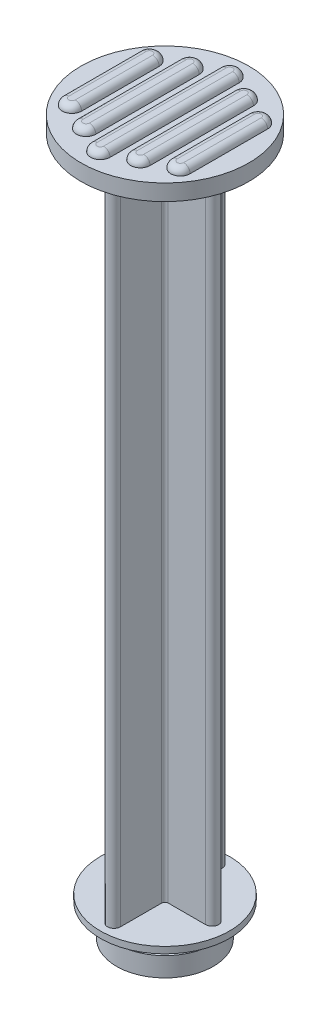
from build123d import *

# Parameters (mm, degrees)
BOSS_EXTRUDE1_DEPTH = 102
SKETCH3_R           = 13
BOSS_EXTRUDE3_DEPTH = 2.5
BOSS_EXTRUDE4_DEPTH = 1
FILLET1_R           = 1


with BuildPart() as part:
    # Sketch1 → Revolve1 (revolve)
    with BuildSketch(Plane.XY, mode=Mode.PRIVATE) as revolve1_sk:
        Polygon((0, 0), (7.5, 0), (7.5, 3), (6, 3), (6, 5), (10, 5), (10, 6), (0, 6), align=None)
    revolve(revolve1_sk.sketch.rotate(Axis((0, 6, 0), (0, -1, 0)), 180), axis=Axis((0, 6, 0), (0, -1, 0)))

    # Sketch2 → Boss-Extrude1 (add)
    with BuildSketch(Plane(origin=(0, 6, 0), x_dir=(1, 0, 0), z_dir=(0, 1, 0))):
        with BuildLine():
            Line((-1, 7.891889069), (-1, 1.5))
            ThreePointArc((-1, 1.5), (-1.146446609, 1.146446609), (-1.5, 1))
            Line((-1.5, 1), (-7.304889055, 1))
            ThreePointArc((-7.304889055, 1), (-8.304889055, 0), (-7.304889055, -1))
            Line((-7.304889055, -1), (-1.5, -1))
            ThreePointArc((-1.5, -1), (-1.146446609, -1.146446609), (-1, -1.5))
            Line((-1, -1.5), (-1, -7.891889069))
            ThreePointArc((-1, -7.891889069), (0, -8.891889069), (1, -7.891889069))
            Line((1, -7.891889069), (1, -1.5))
            ThreePointArc((1, -1.5), (1.146446609, -1.146446609), (1.5, -1))
            Line((1.5, -1), (7.304889055, -1))
            ThreePointArc((7.304889055, -1), (8.304889055, 0), (7.304889055, 1))
            Line((7.304889055, 1), (1.5, 1))
            ThreePointArc((1.5, 1), (1.146446609, 1.146446609), (1, 1.5))
            Line((1, 1.5), (1, 7.891889069))
            ThreePointArc((1, 7.891889069), (0, 8.891889069), (-1, 7.891889069))
        make_face()
    extrude(amount=BOSS_EXTRUDE1_DEPTH)

    # Sketch3 → Boss-Extrude3 (add)
    with BuildSketch(Plane(origin=(0, 108, 0), x_dir=(1, 0, 0), z_dir=(0, 1, 0))):
        with Locations(Location((0, 0, 0), (0, 0, 180))):
            Circle(SKETCH3_R)
    extrude(amount=BOSS_EXTRUDE3_DEPTH)

    # Sketch4 → Boss-Extrude4 (add)
    with BuildSketch(Plane(origin=(0, 110.5, 0), x_dir=(1, 0, 0), z_dir=(0, 1, 0))):
        with BuildLine():
            Line((-1.5, 10), (-1.5, -10))
            ThreePointArc((-1.5, -10), (0, -11.5), (1.5, -10))
            Line((1.5, -10), (1.5, 10))
            ThreePointArc((1.5, 10), (0, 11.5), (-1.5, 10))
        make_face()
        with BuildLine():
            Line((-5.7, 8), (-5.7, -8))
            ThreePointArc((-5.7, -8), (-4.2, -9.5), (-2.7, -8))
            Line((-2.7, -8), (-2.7, 8))
            ThreePointArc((-2.7, 8), (-4.2, 9.5), (-5.7, 8))
        make_face()
        with BuildLine():
            Line((-9.9, 6), (-9.9, -6))
            ThreePointArc((-9.9, -6), (-8.4, -7.5), (-6.9, -6))
            Line((-6.9, -6), (-6.9, 6))
            ThreePointArc((-6.9, 6), (-8.4, 7.5), (-9.9, 6))
        make_face()
        with BuildLine():
            Line((6.9, 6), (6.9, -6))
            ThreePointArc((6.9, -6), (8.4, -7.5), (9.9, -6))
            Line((9.9, -6), (9.9, 6))
            ThreePointArc((9.9, 6), (8.4, 7.5), (6.9, 6))
        make_face()
        with BuildLine():
            Line((2.7, 8), (2.7, -8))
            ThreePointArc((2.7, -8), (4.2, -9.5), (5.7, -8))
            Line((5.7, -8), (5.7, 8))
            ThreePointArc((5.7, 8), (4.2, 9.5), (2.7, 8))
        make_face()
    extrude(amount=BOSS_EXTRUDE4_DEPTH)

    # Fillet1
    fillet1_edges = [part.edges().sort_by_distance(p)[0] for p in [
        (9.9, 111.5, 0),
        (8.4, 111.5, 7.5),
        (6.9, 111.5, 0),
        (8.4, 111.5, -7.5),
        (2.7, 111.5, 0),
        (4.2, 111.5, -9.5),
        (5.7, 111.5, 0),
        (4.2, 111.5, 9.5),
        (1.5, 111.5, 0),
        (0, 111.5, 11.5),
        (-1.5, 111.5, 0),
        (0, 111.5, -11.5),
        (-5.7, 111.5, 0),
        (-4.2, 111.5, -9.5),
        (-2.7, 111.5, 0),
        (-4.2, 111.5, 9.5),
        (-6.9, 111.5, 0),
        (-8.4, 111.5, 7.5),
        (-9.9, 111.5, 0),
        (-8.4, 111.5, -7.5),
    ]]
    fillet(fillet1_edges, radius=FILLET1_R - 0.0001)  # a hair under: the kernel refuses the full size


solid = part.part
